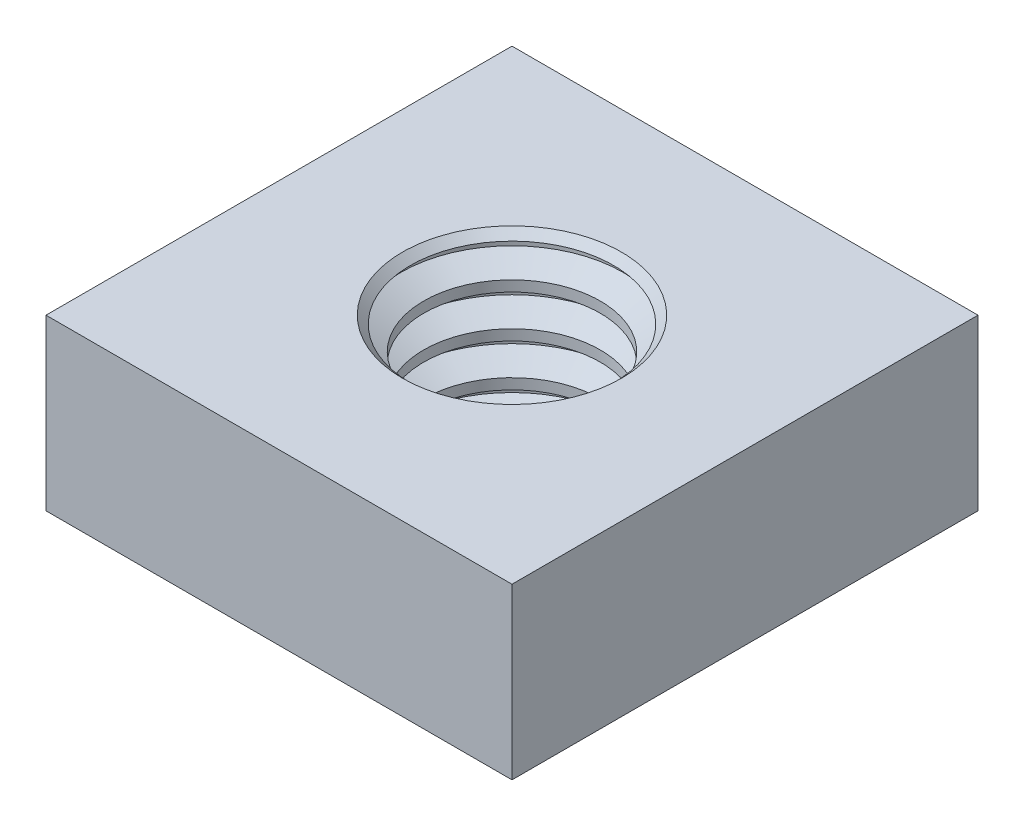
from build123d import *

# Parameters (mm, degrees)
SKETCH1_W       = 8.73125
SKETCH1_H       = 8.73125
EXTRUDE1_DEPTH  = 3.175
LPATTERN2_COUNT = 5
LPATTERN2_PITCH = 0.79375
CHAMFER1_SIZE   = 0.396875
CHAMFER1_SIZE_2 = 0.290532664


with BuildPart() as part:
    # Sketch1 → Extrude1 (new body)
    with BuildSketch(Plane(origin=(0, 0, 0), x_dir=(1, 0, 0), z_dir=(0, 1, 0))):
        Rectangle(SKETCH1_W, SKETCH1_H)
    extrude(amount=EXTRUDE1_DEPTH)

    # Sketch2 → Cut-Revolve1 (revolve, cut)
    with BuildSketch(Plane.XY, mode=Mode.PRIVATE) as cut_revolve1_sk:
        Polygon((0, 3.175), (1.65317021, 3.175), (2.0828, 2.926953125), (2.0828, 2.827734375), (1.65317021, 2.5796875), (1.65317021, 2.38125), (0, 2.38125), align=None)
    cut_revolve1 = revolve(cut_revolve1_sk.sketch.rotate(Axis((0, 1.663578541, 0), (0, -1, 0)), 90), axis=Axis((0, 1.663578541, 0), (0, -1, 0)), mode=Mode.SUBTRACT)

    # LPattern2: Cut-Revolve1 ×5
    with Locations(*[(0, -i * LPATTERN2_PITCH, 0) for i in range(1, LPATTERN2_COUNT)]):
        add(cut_revolve1, mode=Mode.SUBTRACT)

    # Chamfer1
    # the kernel refuses this chamfer: 0.396875, 0.290532664 mm, written as the material it takes off along each edge
    with BuildSketch(Plane(origin=(0, 3.175, 0), x_dir=(0, 0, 1), z_dir=(1, 0, 0))) as chamfer1_piece_1:
        Polygon((1.65317021 + CHAMFER1_SIZE, 0), (1.65317021 + CHAMFER1_SIZE_2 * 0.866025404541, CHAMFER1_SIZE_2 * 0.500000000437), (1.65317021, 0), align=None)
    revolve(axis=Axis((0, 3.175, 0), (0, -1, 0)), mode=Mode.SUBTRACT)


solid = part.part
